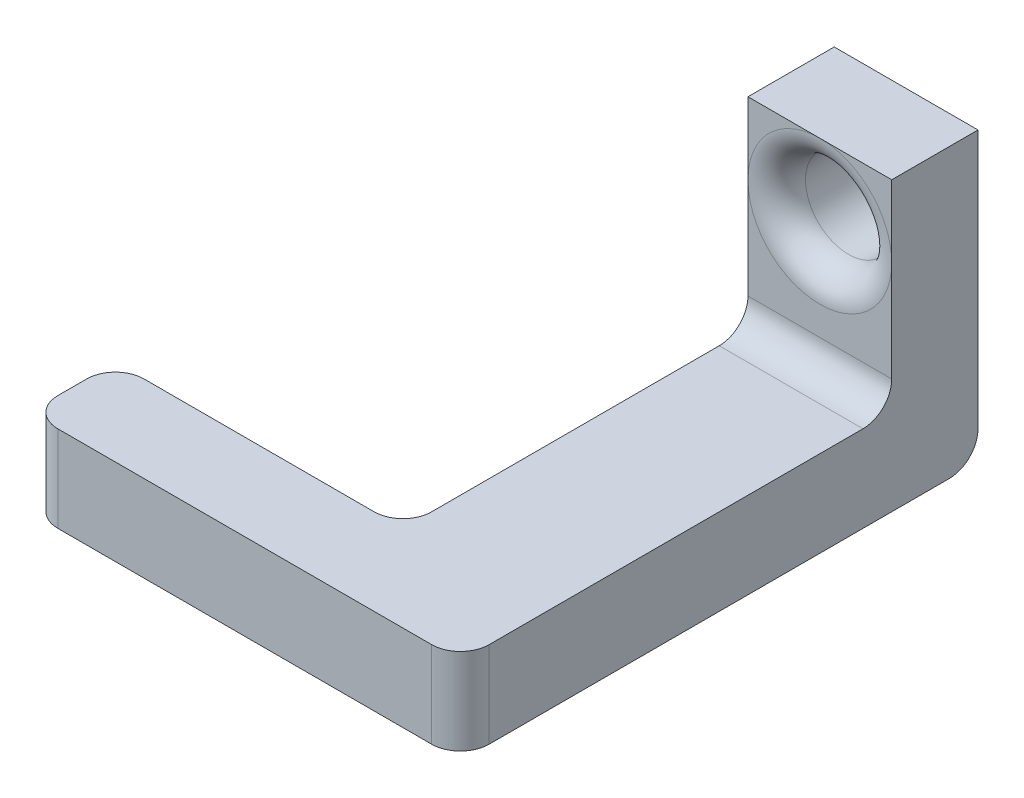
from build123d import *

# Parameters (mm, degrees)
SKETCH1_W           = 5
SKETCH1_H           = 10
SKETCH1_R           = 1.5
BOSS_EXTRUDE1_DEPTH = 3
SKETCH2_W           = 5
SKETCH2_H           = 3
BOSS_EXTRUDE2_DEPTH = 15
SKETCH3_W           = 3
SKETCH3_H           = 3
BOSS_EXTRUDE3_DEPTH = 10
FILLET1_R           = 1
FILLET2_R           = 1
FILLET3_R           = 1
FILLET4_R           = 1
FILLET5_R           = 1
FILLET6_R           = 1
FILLET7_R           = 1


with BuildPart() as part:
    # Sketch1 → Boss-Extrude1 (new body)
    with BuildSketch(Plane.XY):
        with Locations((-4.401041667, 3.828125)):
            Rectangle(SKETCH1_W, SKETCH1_H)
        with Locations((-4.401041667, 6.328125)):
            Circle(SKETCH1_R, mode=Mode.SUBTRACT)
    extrude(amount=BOSS_EXTRUDE1_DEPTH)

    # Sketch2 → Boss-Extrude2 (add)
    with BuildSketch(Plane.XY.offset(3)):
        with Locations((-4.401041667, 0.328125)):
            Rectangle(SKETCH2_W, SKETCH2_H)
    extrude(amount=BOSS_EXTRUDE2_DEPTH)

    # Sketch3 → Boss-Extrude3 (add)
    with BuildSketch(Plane.ZY.offset(6.901041667)):
        with Locations((16.5, 0.328125)):
            Rectangle(SKETCH3_W, SKETCH3_H)
    extrude(amount=BOSS_EXTRUDE3_DEPTH)

    # Fillet1
    fillet1_edges = [part.edges().sort_by_distance(p)[0] for p in [
        (-6.901041667, 0.328125, 15),
    ]]
    fillet(fillet1_edges, radius=FILLET1_R)

    # Fillet2
    fillet2_edges = [part.edges().sort_by_distance(p)[0] for p in [
        (-1.901041667, 0.328125, 18),
    ]]
    fillet(fillet2_edges, radius=FILLET2_R)

    # Fillet3
    fillet3_edges = [part.edges().sort_by_distance(p)[0] for p in [
        (-16.901041667, 0.328125, 15),
    ]]
    fillet(fillet3_edges, radius=FILLET3_R)

    # Fillet4
    fillet4_edges = [part.edges().sort_by_distance(p)[0] for p in [
        (-16.901041667, 0.328125, 18),
    ]]
    fillet(fillet4_edges, radius=FILLET4_R)

    # Fillet5
    fillet5_edges = [part.edges().sort_by_distance(p)[0] for p in [
        (-5.901041667, 6.328125, 3),
    ]]
    fillet(fillet5_edges, radius=FILLET5_R - 0.0001)  # a hair under: the kernel refuses the full size

    # Fillet6
    fillet6_edges = [part.edges().sort_by_distance(p)[0] for p in [
        (-4.401041667, -1.171875, 0),
    ]]
    fillet(fillet6_edges, radius=FILLET6_R)

    # Fillet7
    fillet7_edges = [part.edges().sort_by_distance(p)[0] for p in [
        (-4.401041667, 1.828125, 3),
    ]]
    fillet(fillet7_edges, radius=FILLET7_R)


solid = part.part
